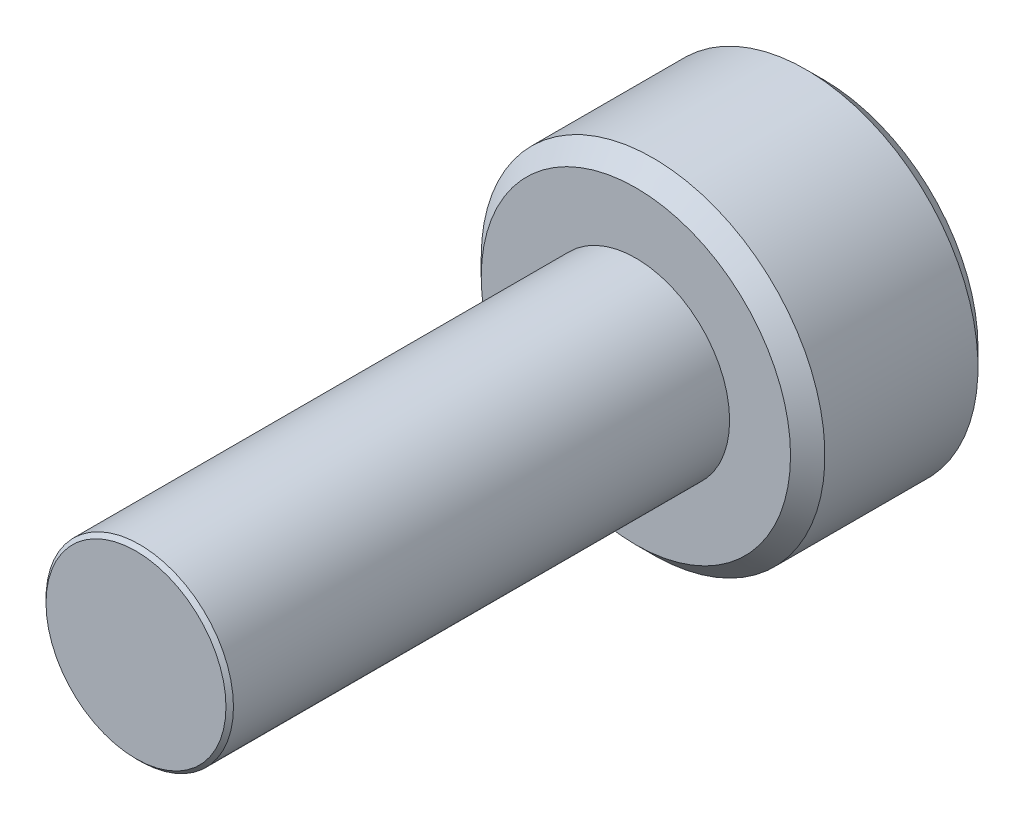
from build123d import *

# Parameters (mm, degrees)
SKETCH1_R            = 1.5
EXTRUDE1_DEPTH       = 8
CUT_SWEEP1_PITCH     = 0.5
SKETCH6_R            = 2.75
EXTRUDE2_DEPTH       = 3
CUT_EXTRUDE1_DEPTH   = 1.875
CHAMFER1_SIZE        = 0.275
SKETCH10_R           = 1.5
PARTIAL_THREAD_DEPTH = 8
CHAMFER2_SIZE        = 0.06


with BuildPart() as part:
    # Sketch1 → Extrude1 (new body)
    with BuildSketch(Plane.XY):
        Circle(SKETCH1_R)
    extrude(amount=-EXTRUDE1_DEPTH)

    # Cut-Sweep1: the profile of Sketch3 profile screwed along a right-hand helix of 17 turns, 6 arcs to a turn; built about Z, then put on its axis
    cut_sweep1_z = Axis((0, 0, 0), (0, 0, 1))
    cut_sweep1_corners = [(1.5003, 0, -0.437673205), (1.175240474, 0, -0.25), (1.175240474, 0, -0.1875), (1.5003, 0, 0.000173205)]
    with BuildLine(mode=Mode.PRIVATE) as cut_sweep1_profile:
        Line(cut_sweep1_corners[0], cut_sweep1_corners[1])
        Line(cut_sweep1_corners[1], cut_sweep1_corners[2])
        Line(cut_sweep1_corners[2], cut_sweep1_corners[3])
        Line(cut_sweep1_corners[3], cut_sweep1_corners[0])
    cut_sweep1_cap = Face(cut_sweep1_profile.wire())
    cut_sweep1_turn_angles = [0, 30, 60, 90, 120, 150, 180, 210, 240, 270, 300, 330, 360]
    cut_sweep1_turn_weights = [1, 0.8660254037844387, 1, 0.8660254037844387, 1, 0.8660254037844387, 1, 0.8660254037844387, 1, 0.8660254037844387, 1, 0.8660254037844387, 1]
    cut_sweep1_turn_rails = [Edge.make_bspline([Vector(p[0], p[1], 0).rotate(cut_sweep1_z, cut_sweep1_turn_angles[k]) / cut_sweep1_turn_weights[k] + Vector(0, 0, p[2] + CUT_SWEEP1_PITCH * cut_sweep1_turn_angles[k] / 360) for k in range(13)], [0, 0, 0, 1, 1, 2, 2, 3, 3, 4, 4, 5, 5, 6, 6, 6], 2, cut_sweep1_turn_weights) for p in cut_sweep1_corners]
    cut_sweep1_turn_sides = [Face.make_surface_from_curves(cut_sweep1_turn_rails[p[0]], cut_sweep1_turn_rails[p[1]]) for p in [(0, 1), (1, 2), (2, 3), (3, 0)]]
    cut_sweep1 = Plane(origin=(0, 0, 0), x_dir=(0, 1, 0), z_dir=(0, 0, -1)) * Solid(Shell([*[p.moved(Location((0, 0, CUT_SWEEP1_PITCH * i))) for i in range(17) for p in cut_sweep1_turn_sides], cut_sweep1_cap, cut_sweep1_cap.rotate(cut_sweep1_z, 6120).moved(Location((0, 0, CUT_SWEEP1_PITCH * 6120 / 360)))]))
    add(cut_sweep1, mode=Mode.SUBTRACT)

    # Sketch4 → Cut-Revolve1 (revolve, cut)
    with BuildSketch(Plane(origin=(0, 0, 0), x_dir=(0, 0, -1), z_dir=(1, 0, 0)), mode=Mode.PRIVATE) as cut_revolve1_sk:
        Polygon((0.405251783, 1.5), (0, 0.921240474), (0, 1.5), align=None)
    revolve(cut_revolve1_sk.sketch.rotate(Axis((0, 0, 0), (0, 0, -1)), 270), axis=Axis((0, 0, 0), (0, 0, -1)), mode=Mode.SUBTRACT)

    # Sketch6 → Extrude2 (add)
    with BuildSketch(Plane(origin=(0, 0, -8), x_dir=(-1, 0, 0), z_dir=(0, 0, -1))):
        Circle(SKETCH6_R)
    extrude(amount=EXTRUDE2_DEPTH)

    # Sketch7 → Cut-Extrude1 (cut)
    with BuildSketch(Plane(origin=(0, 0, -11), x_dir=(-1, 0, 0), z_dir=(0, 0, -1))):
        Polygon((0, 1.443375673), (-1.25, 0.721687836), (-1.25, -0.721687836), (0, -1.443375673), (1.25, -0.721687836), (1.25, 0.721687836), align=None)
    extrude(amount=-CUT_EXTRUDE1_DEPTH, mode=Mode.SUBTRACT)

    # Cut-Extrude2 cone 1 section (through the dimple's axis) → Cut-Extrude2 (revolve, cut)
    with BuildSketch(Plane(origin=(0, 0, -11), x_dir=(0, 1, 0), z_dir=(1, 0, 0))):
        Polygon((0, 0), (1.443375673, 0), (0, 1.443375673), align=None)
    revolve(axis=Axis((0, 0, -11), (0, 0, 1)), mode=Mode.SUBTRACT)

    # Chamfer1
    chamfer1_edges = [part.edges().sort_by_distance(p)[0] for p in [
        (2.75, 0, -8),
        (2.75, 0, -11),
    ]]
    chamfer(chamfer1_edges, length=CHAMFER1_SIZE)


with BuildPart() as body_2:
    # Sketch10 → partial thread (new body)
    with BuildSketch(Plane.XY.offset(-8)):
        Circle(SKETCH10_R)
    extrude(amount=PARTIAL_THREAD_DEPTH)

    # Chamfer2
    chamfer2_edges = [body_2.edges().sort_by_distance(p)[0] for p in [
        (-1.5, 0, 0),
    ]]
    chamfer(chamfer2_edges, length=CHAMFER2_SIZE)


with BuildPart() as part_1:
    add(part.part)

    # Combine1: union body 2
    add(body_2.part)


solid = part_1.part
